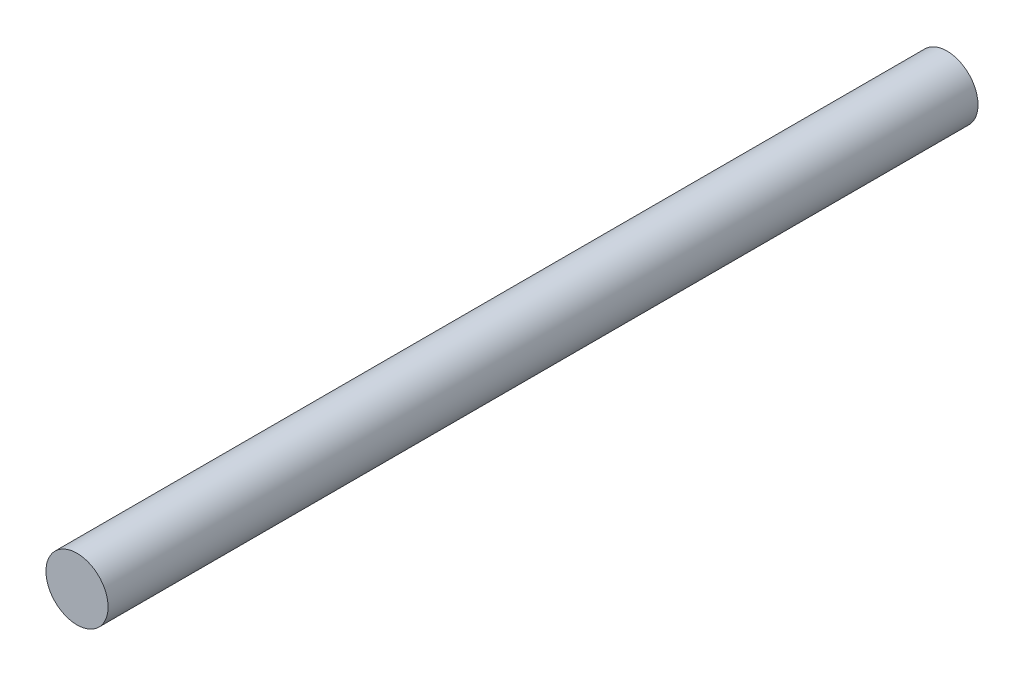
from build123d import *

# Parameters (mm, degrees)
SKETCH1_R           = 2.5
BOSS_EXTRUDE1_DEPTH = 35


with BuildPart() as part:
    # Sketch1 → Boss-Extrude1 (new, symmetric)
    with BuildSketch(Plane.XY):
        Circle(SKETCH1_R)
    extrude(amount=BOSS_EXTRUDE1_DEPTH, both=True)


solid = part.part
